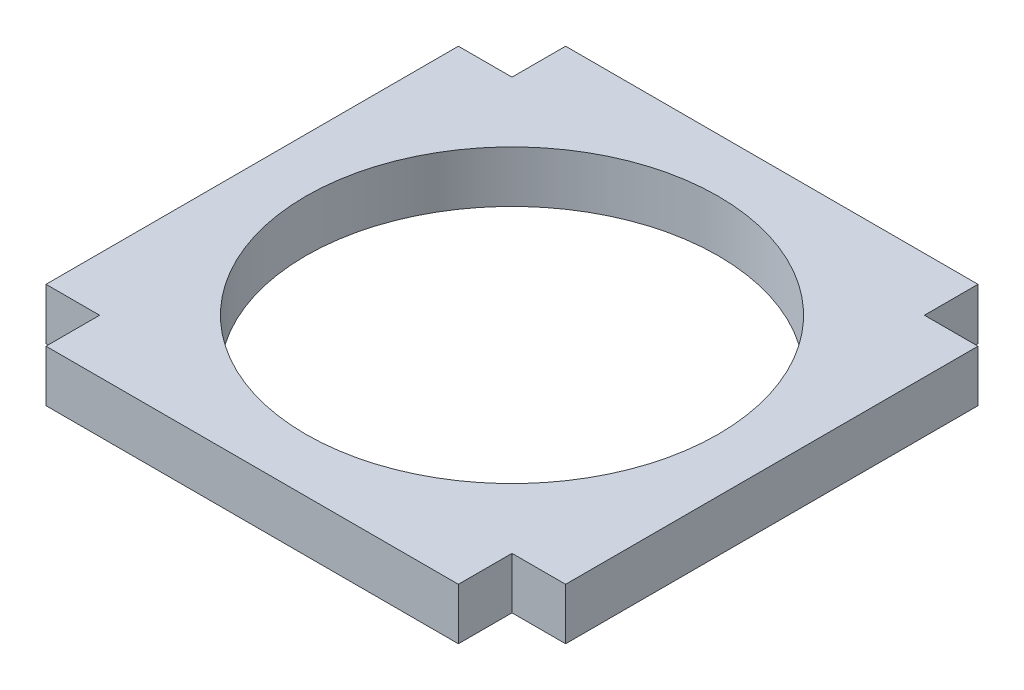
from build123d import *

# Parameters (mm, degrees)
SKETCH2_W                    = 304.8
SKETCH2_H                    = 304.8
BOSS_EXTRUDE1_DEPTH          = 3.175
CUT_EXTRUDE1_DEPTH           = 348.408852067
CUT_EXTRUDE1_DEPTH_BACK      = 348.408852067
SKETCH3_W                    = 304.8
SKETCH3_H                    = 304.8
SKETCH3_R                    = 12.7
SKETCH3_R_2                  = 8.89
BODY_DELETE_KEEP_1_OUTLINE_R = 8.89
BODY_DELETE_KEEP_1_DEPTH     = 3.175


# Read off the part's stored shape, not the designer's step: Body-Delete/Keep 1
with BuildPart() as part:
    # Sketch2 → Boss-Extrude1 (new body)
    with BuildSketch(Plane(origin=(0, 0, 0), x_dir=(1, 0, 0), z_dir=(0, 1, 0))):
        with Locations((-56.763509666, -124.968808797)):
            Rectangle(SKETCH2_W, SKETCH2_H)
    extrude(amount=BOSS_EXTRUDE1_DEPTH)

    # Sketch3 → Cut-Extrude1 (cut, two sides: drawn at the far end of the back side and taken through both)
    # profile 1 of 3: a face of its own
    with BuildSketch(Plane(origin=(0, 3.175, 0), x_dir=(1, 0, 0), z_dir=(0, 1, 0)).offset(-CUT_EXTRUDE1_DEPTH_BACK)):
        with Locations((-56.763509666, -124.968808797)):
            Rectangle(SKETCH3_W, SKETCH3_H)
        Polygon((-188.253637726, -268.695366412), (-192.063637726, -268.695366412), (-192.063637726, -265.393366412), (-198.413637726, -265.393366412), (-188.253637726, -205.195366412), align=None, mode=Mode.SUBTRACT)
        Polygon((-185.713637726, -265.393366412), (-175.553637726, -205.195366412), (-175.553637726, -268.695366412), (-179.363637726, -268.695366412), (-179.363637726, -265.393366412), align=None, mode=Mode.SUBTRACT)
        Polygon((-162.853637726, -268.695366412), (-166.663637726, -268.695366412), (-166.663637726, -265.393366412), (-173.013637726, -265.393366412), (-162.853637726, -205.195366412), align=None, mode=Mode.SUBTRACT)
        Polygon((-150.153637726, -268.695366412), (-153.963637726, -268.695366412), (-153.963637726, -265.393366412), (-160.313637726, -265.393366412), (-150.153637726, -205.195366412), align=None, mode=Mode.SUBTRACT)
        Polygon((-147.613637726, -265.393366412), (-137.453637726, -205.195366412), (-137.453637726, -268.695366412), (-141.263637726, -268.695366412), (-141.263637726, -265.393366412), align=None, mode=Mode.SUBTRACT)
        Polygon((-128.563637726, -265.393366412), (-134.913637726, -265.393366412), (-124.753637726, -205.195366412), (-124.753637726, -268.695366412), (-128.563637726, -268.695366412), align=None, mode=Mode.SUBTRACT)
        Polygon((-122.213637726, -265.393366412), (-112.053637726, -205.195366412), (-112.053637726, -268.695366412), (-115.863637726, -268.695366412), (-115.863637726, -265.393366412), align=None, mode=Mode.SUBTRACT)
        Polygon((-99.353637726, -268.695366412), (-103.163637726, -268.695366412), (-103.163637726, -265.393366412), (-109.513637726, -265.393366412), (-99.353637726, -205.195366412), align=None, mode=Mode.SUBTRACT)
        Polygon((-90.463637726, -268.695366412), (-90.463637726, -265.393366412), (-96.813637726, -265.393366412), (-86.653637726, -205.195366412), (-86.653637726, -268.695366412), align=None, mode=Mode.SUBTRACT)
        Polygon((-84.113637726, -265.393366412), (-73.953637726, -205.195366412), (-73.953637726, -268.695366412), (-77.763637726, -268.695366412), (-77.763637726, -265.393366412), align=None, mode=Mode.SUBTRACT)
        Polygon((-71.413637726, -265.393366412), (-61.253637726, -205.195366412), (-61.253637726, -268.695366412), (-65.063637726, -268.695366412), (-65.063637726, -265.393366412), align=None, mode=Mode.SUBTRACT)
        with BuildLine():
            ThreePointArc((-132.963509666, -135.600090559), (-133.446874634, -138.030130355), (-134.823381605, -140.09021862))
            Line((-134.823381605, -140.09021862), (-188.253637726, -193.520474741))
            ThreePointArc((-188.253637726, -193.520474741), (-190.313725991, -194.896981712), (-192.743765787, -195.38034668))
            Line((-192.743765787, -195.38034668), (-196.463509666, -195.38034668))
            Line((-196.463509666, -195.38034668), (-196.463509666, -131.88034668))
            Line((-196.463509666, -131.88034668), (-132.963509666, -131.88034668))
            Line((-132.963509666, -131.88034668), (-132.963509666, -135.600090559))
        make_face(mode=Mode.SUBTRACT)
        with BuildLine():
            Line((-126.613509666, -195.38034668), (-126.613509666, -131.88034668))
            Line((-126.613509666, -131.88034668), (-63.113509666, -131.88034668))
            Line((-63.113509666, -131.88034668), (-63.113509666, -135.600090559))
            ThreePointArc((-63.113509666, -135.600090559), (-63.596874634, -138.030130355), (-64.973381605, -140.09021862))
            Line((-64.973381605, -140.09021862), (-118.403637726, -193.520474741))
            ThreePointArc((-118.403637726, -193.520474741), (-120.463725991, -194.896981712), (-122.893765787, -195.38034668))
            Line((-122.893765787, -195.38034668), (-126.613509666, -195.38034668))
        make_face(mode=Mode.SUBTRACT)
        Polygon((-52.363637726, -268.695366412), (-52.363637726, -265.393366412), (-58.713637726, -265.393366412), (-48.553637726, -205.195366412), (-48.553637726, -268.695366412), align=None, mode=Mode.SUBTRACT)
        Polygon((-35.853637726, -205.195366412), (-35.853637726, -268.695366412), (-39.663637726, -268.695366412), (-39.663637726, -265.393366412), (-46.013637726, -265.393366412), align=None, mode=Mode.SUBTRACT)
        Polygon((-23.153637726, -205.195366412), (-23.153637726, -268.695366412), (-26.963637726, -268.695366412), (-26.963637726, -265.393366412), (-33.313637726, -265.393366412), align=None, mode=Mode.SUBTRACT)
        Polygon((-20.613637726, -265.393366412), (-10.453637726, -205.195366412), (-10.453637726, -268.695366412), (-14.263637726, -268.695366412), (-14.263637726, -265.393366412), align=None, mode=Mode.SUBTRACT)
        Polygon((-1.563637726, -268.695366412), (-1.563637726, -265.393366412), (-7.913637726, -265.393366412), (2.246362274, -205.195366412), (2.246362274, -268.695366412), align=None, mode=Mode.SUBTRACT)
        with BuildLine():
            Line((-53.043765787, -195.38034668), (-56.763509666, -195.38034668))
            Line((-56.763509666, -195.38034668), (-56.763509666, -131.88034668))
            Line((-56.763509666, -131.88034668), (6.736490334, -131.88034668))
            Line((6.736490334, -131.88034668), (6.736490334, -135.600090559))
            ThreePointArc((6.736490334, -135.600090559), (6.253125366, -138.030130355), (4.876618395, -140.09021862))
            Line((4.876618395, -140.09021862), (-48.553637726, -193.520474741))
            ThreePointArc((-48.553637726, -193.520474741), (-50.613725991, -194.896981712), (-53.043765787, -195.38034668))
        make_face(mode=Mode.SUBTRACT)
        with BuildLine():
            Line((13.086490334, -131.88034668), (76.586490334, -131.88034668))
            Line((76.586490334, -131.88034668), (76.586490334, -135.600090559))
            ThreePointArc((76.586490334, -135.600090559), (76.103125366, -138.030130355), (74.726618395, -140.09021862))
            Line((74.726618395, -140.09021862), (21.296362274, -193.520474741))
            ThreePointArc((21.296362274, -193.520474741), (19.236274009, -194.896981712), (16.806234213, -195.38034668))
            Line((16.806234213, -195.38034668), (13.086490334, -195.38034668))
            Line((13.086490334, -195.38034668), (13.086490334, -131.88034668))
        make_face(mode=Mode.SUBTRACT)
        with BuildLine():
            Line((-196.463509666, -125.53034668), (-196.463509666, -62.03034668))
            Line((-196.463509666, -62.03034668), (-132.963509666, -62.03034668))
            Line((-132.963509666, -62.03034668), (-132.963509666, -65.750090559))
            ThreePointArc((-132.963509666, -65.750090559), (-133.10773728, -67.095783354), (-133.533868437, -68.38034668))
            ThreePointArc((-133.533868437, -68.38034668), (-134.095097913, -69.368194866), (-134.823381605, -70.24021862))
            Line((-134.823381605, -70.24021862), (-188.253637726, -123.670474741))
            ThreePointArc((-188.253637726, -123.670474741), (-189.12566148, -124.398758433), (-190.113509666, -124.959987909))
            ThreePointArc((-190.113509666, -124.959987909), (-191.398072992, -125.386119066), (-192.743765787, -125.53034668))
            Line((-192.743765787, -125.53034668), (-196.463509666, -125.53034668))
        make_face(mode=Mode.SUBTRACT)
        with BuildLine():
            Line((-122.893765787, -125.53034668), (-126.613509666, -125.53034668))
            Line((-126.613509666, -125.53034668), (-126.613509666, -62.03034668))
            Line((-126.613509666, -62.03034668), (-63.113509666, -62.03034668))
            Line((-63.113509666, -62.03034668), (-63.113509666, -65.750090559))
            ThreePointArc((-63.113509666, -65.750090559), (-63.596874634, -68.180130355), (-64.973381605, -70.24021862))
            Line((-64.973381605, -70.24021862), (-118.403637726, -123.670474741))
            ThreePointArc((-118.403637726, -123.670474741), (-120.463725991, -125.046981712), (-122.893765787, -125.53034668))
        make_face(mode=Mode.SUBTRACT)
        Polygon((-196.463509666, -48.768808797), (-196.463509666, 14.731191203), (-192.653509666, 14.731191203), (-192.653509666, 11.429191203), (-186.303509666, 11.429191203), align=None, mode=Mode.SUBTRACT)
        Polygon((-183.763509666, 14.731191203), (-179.953509666, 14.731191203), (-179.953509666, 11.429191203), (-173.603509666, 11.429191203), (-183.763509666, -48.768808797), align=None, mode=Mode.SUBTRACT)
        Polygon((-171.063509666, 14.731191203), (-167.253509666, 14.731191203), (-167.253509666, 11.429191203), (-160.903509666, 11.429191203), (-171.063509666, -48.768808797), align=None, mode=Mode.SUBTRACT)
        Polygon((-158.363509666, 14.731191203), (-154.553509666, 14.731191203), (-154.553509666, 11.429191203), (-148.203509666, 11.429191203), (-158.363509666, -48.768808797), align=None, mode=Mode.SUBTRACT)
        Polygon((-145.663509666, 14.731191203), (-141.853509666, 14.731191203), (-141.853509666, 11.429191203), (-135.503509666, 11.429191203), (-145.663509666, -48.768808797), align=None, mode=Mode.SUBTRACT)
        Polygon((-132.963509666, 14.731191203), (-129.153509666, 14.731191203), (-129.153509666, 11.429191203), (-122.803509666, 11.429191203), (-132.963509666, -48.768808797), align=None, mode=Mode.SUBTRACT)
        Polygon((-120.263509666, 14.731191203), (-116.453509666, 14.731191203), (-116.453509666, 11.429191203), (-110.103509666, 11.429191203), (-120.263509666, -48.768808797), align=None, mode=Mode.SUBTRACT)
        Polygon((-107.563509666, 14.731191203), (-103.753509666, 14.731191203), (-103.753509666, 11.429191203), (-97.403509666, 11.429191203), (-107.563509666, -48.768808797), align=None, mode=Mode.SUBTRACT)
        Polygon((-94.863509666, 14.731191203), (-91.053509666, 14.731191203), (-91.053509666, 11.429191203), (-84.703509666, 11.429191203), (-94.863509666, -48.768808797), align=None, mode=Mode.SUBTRACT)
        Polygon((-82.163509666, 14.731191203), (-78.353509666, 14.731191203), (-78.353509666, 11.429191203), (-72.003509666, 11.429191203), (-82.163509666, -48.768808797), align=None, mode=Mode.SUBTRACT)
        Polygon((-69.463509666, 14.731191203), (-65.653509666, 14.731191203), (-65.653509666, 11.429191203), (-59.303509666, 11.429191203), (-69.463509666, -48.768808797), align=None, mode=Mode.SUBTRACT)
        with BuildLine():
            Line((-53.043765787, -125.53034668), (-56.763509666, -125.53034668))
            Line((-56.763509666, -125.53034668), (-56.763509666, -62.03034668))
            Line((-56.763509666, -62.03034668), (6.736490334, -62.03034668))
            Line((6.736490334, -62.03034668), (6.736490334, -65.750090559))
            ThreePointArc((6.736490334, -65.750090559), (6.253125366, -68.180130355), (4.876618395, -70.24021862))
            Line((4.876618395, -70.24021862), (-48.553637726, -123.670474741))
            ThreePointArc((-48.553637726, -123.670474741), (-50.613725991, -125.046981712), (-53.043765787, -125.53034668))
        make_face(mode=Mode.SUBTRACT)
        with BuildLine():
            Line((16.806234213, -125.53034668), (13.086490334, -125.53034668))
            Line((13.086490334, -125.53034668), (13.086490334, -62.03034668))
            Line((13.086490334, -62.03034668), (76.586490334, -62.03034668))
            Line((76.586490334, -62.03034668), (76.586490334, -65.750090559))
            ThreePointArc((76.586490334, -65.750090559), (76.103125366, -68.180130355), (74.726618395, -70.24021862))
            Line((74.726618395, -70.24021862), (21.296362274, -123.670474741))
            ThreePointArc((21.296362274, -123.670474741), (19.236274009, -125.046981712), (16.806234213, -125.53034668))
        make_face(mode=Mode.SUBTRACT)
        Polygon((-56.763509666, 14.731191203), (-52.953509666, 14.731191203), (-52.953509666, 11.429191203), (-46.603509666, 11.429191203), (-56.763509666, -48.768808797), align=None, mode=Mode.SUBTRACT)
        Polygon((-44.063509666, 14.731191203), (-40.253509666, 14.731191203), (-40.253509666, 11.429191203), (-33.903509666, 11.429191203), (-44.063509666, -48.768808797), align=None, mode=Mode.SUBTRACT)
        Polygon((-31.363509666, 14.731191203), (-27.553509666, 14.731191203), (-27.553509666, 11.429191203), (-21.203509666, 11.429191203), (-31.363509666, -48.768808797), align=None, mode=Mode.SUBTRACT)
        Polygon((-18.663509666, 14.731191203), (-14.853509666, 14.731191203), (-14.853509666, 11.429191203), (-8.503509666, 11.429191203), (-18.663509666, -48.768808797), align=None, mode=Mode.SUBTRACT)
        Polygon((-5.963509666, 14.731191203), (-2.153509666, 14.731191203), (-2.153509666, 11.429191203), (4.196490334, 11.429191203), (-5.963509666, -48.768808797), align=None, mode=Mode.SUBTRACT)
        Polygon((57.536490334, -48.768808797), (57.536490334, -52.070808797), (32.136490334, -52.070808797), (32.136490334, -48.768808797), (28.834490334, -48.768808797), (28.834490334, -23.368808797), (32.136490334, -23.368808797), (32.136490334, -20.066808797), (57.536490334, -20.066808797), (57.536490334, -23.368808797), (60.838490334, -23.368808797), (60.838490334, -48.768808797), align=None, mode=Mode.SUBTRACT)
        Polygon((28.834490334, 14.731191203), (32.136490334, 14.731191203), (32.136490334, 18.033191203), (57.536490334, 18.033191203), (57.536490334, 14.731191203), (60.838490334, 14.731191203), (60.838490334, -10.668808797), (57.536490334, -10.668808797), (57.536490334, -13.970808797), (32.136490334, -13.970808797), (32.136490334, -10.668808797), (28.834490334, -10.668808797), align=None, mode=Mode.SUBTRACT)
    # profile 2 of 3: a face of its own
    with BuildSketch(Plane(origin=(0, 3.175, 0), x_dir=(1, 0, 0), z_dir=(0, 1, 0)).offset(-CUT_EXTRUDE1_DEPTH_BACK)):
        with Locations(Location((44.836490334, -36.068808797, 0), (0, 0, 270))):
            Circle(SKETCH3_R)
    # profile 3 of 3: a face of its own
    with BuildSketch(Plane(origin=(0, 3.175, 0), x_dir=(1, 0, 0), z_dir=(0, 1, 0)).offset(-CUT_EXTRUDE1_DEPTH_BACK)):
        with Locations(Location((44.836490334, 2.031191203, 0), (0, 0, 270))):
            Circle(SKETCH3_R_2)
    extrude(amount=CUT_EXTRUDE1_DEPTH + CUT_EXTRUDE1_DEPTH_BACK, mode=Mode.SUBTRACT)

    # Body-Delete/Keep 1 outline → Body-Delete/Keep 1 (cut)
    # profile 1 of 41: a face of its own
    with BuildSketch(Plane(origin=(0, 0, 0), x_dir=(1, 0, 0), z_dir=(0, 1, 0))):
        Polygon((28.834490334, -10.668808797), (32.136490334, -10.668808797), (32.136490334, -13.970808797), (57.536490334, -13.970808797), (57.536490334, -10.668808797), (60.838490334, -10.668808797), (60.838490334, 14.731191203), (57.536490334, 14.731191203), (57.536490334, 18.033191203), (32.136490334, 18.033191203), (32.136490334, 14.731191203), (28.834490334, 14.731191203), align=None)
        with Locations((44.836490334, 2.031191203)):
            Circle(BODY_DELETE_KEEP_1_OUTLINE_R, mode=Mode.SUBTRACT)
    # profile 2 of 41: a face of its own
    with BuildSketch(Plane(origin=(0, 0, 0), x_dir=(1, 0, 0), z_dir=(0, 1, 0))):
        Polygon((-192.653509666, 11.429191203), (-192.653509666, 14.731191203), (-196.463509666, 14.731191203), (-196.463509666, -48.768808797), (-186.303509666, 11.429191203), align=None)
    # profile 3 of 41: a face of its own
    with BuildSketch(Plane(origin=(0, 0, 0), x_dir=(1, 0, 0), z_dir=(0, 1, 0))):
        Polygon((-2.153509666, 11.429191203), (-2.153509666, 14.731191203), (-5.963509666, 14.731191203), (-5.963509666, -48.768808797), (4.196490334, 11.429191203), align=None)
    # profile 4 of 41: a face of its own
    with BuildSketch(Plane(origin=(0, 0, 0), x_dir=(1, 0, 0), z_dir=(0, 1, 0))):
        Polygon((-27.553509666, 11.429191203), (-27.553509666, 14.731191203), (-31.363509666, 14.731191203), (-31.363509666, -48.768808797), (-21.203509666, 11.429191203), align=None)
    # profile 5 of 41: a face of its own
    with BuildSketch(Plane(origin=(0, 0, 0), x_dir=(1, 0, 0), z_dir=(0, 1, 0))):
        Polygon((-14.853509666, 11.429191203), (-14.853509666, 14.731191203), (-18.663509666, 14.731191203), (-18.663509666, -48.768808797), (-8.503509666, 11.429191203), align=None)
    # profile 6 of 41: a face of its own
    with BuildSketch(Plane(origin=(0, 0, 0), x_dir=(1, 0, 0), z_dir=(0, 1, 0))):
        Polygon((-65.653509666, 11.429191203), (-65.653509666, 14.731191203), (-69.463509666, 14.731191203), (-69.463509666, -48.768808797), (-59.303509666, 11.429191203), align=None)
    # profile 7 of 41: a face of its own
    with BuildSketch(Plane(origin=(0, 0, 0), x_dir=(1, 0, 0), z_dir=(0, 1, 0))):
        Polygon((-91.053509666, 11.429191203), (-91.053509666, 14.731191203), (-94.863509666, 14.731191203), (-94.863509666, -48.768808797), (-84.703509666, 11.429191203), align=None)
    # profile 8 of 41: a face of its own
    with BuildSketch(Plane(origin=(0, 0, 0), x_dir=(1, 0, 0), z_dir=(0, 1, 0))):
        Polygon((-40.253509666, 11.429191203), (-40.253509666, 14.731191203), (-44.063509666, 14.731191203), (-44.063509666, -48.768808797), (-33.903509666, 11.429191203), align=None)
    # profile 9 of 41: a face of its own
    with BuildSketch(Plane(origin=(0, 0, 0), x_dir=(1, 0, 0), z_dir=(0, 1, 0))):
        Polygon((-52.953509666, 11.429191203), (-52.953509666, 14.731191203), (-56.763509666, 14.731191203), (-56.763509666, -48.768808797), (-46.603509666, 11.429191203), align=None)
    # profile 10 of 41: a face of its own
    with BuildSketch(Plane(origin=(0, 0, 0), x_dir=(1, 0, 0), z_dir=(0, 1, 0))):
        Polygon((-141.853509666, 11.429191203), (-141.853509666, 14.731191203), (-145.663509666, 14.731191203), (-145.663509666, -48.768808797), (-135.503509666, 11.429191203), align=None)
    # profile 11 of 41: a face of its own
    with BuildSketch(Plane(origin=(0, 0, 0), x_dir=(1, 0, 0), z_dir=(0, 1, 0))):
        Polygon((-154.553509666, 11.429191203), (-154.553509666, 14.731191203), (-158.363509666, 14.731191203), (-158.363509666, -48.768808797), (-148.203509666, 11.429191203), align=None)
    # profile 12 of 41: a face of its own
    with BuildSketch(Plane(origin=(0, 0, 0), x_dir=(1, 0, 0), z_dir=(0, 1, 0))):
        Polygon((-167.253509666, 11.429191203), (-167.253509666, 14.731191203), (-171.063509666, 14.731191203), (-171.063509666, -48.768808797), (-160.903509666, 11.429191203), align=None)
    # profile 13 of 41: a face of its own
    with BuildSketch(Plane(origin=(0, 0, 0), x_dir=(1, 0, 0), z_dir=(0, 1, 0))):
        Polygon((-78.353509666, 11.429191203), (-78.353509666, 14.731191203), (-82.163509666, 14.731191203), (-82.163509666, -48.768808797), (-72.003509666, 11.429191203), align=None)
    # profile 14 of 41: a face of its own
    with BuildSketch(Plane(origin=(0, 0, 0), x_dir=(1, 0, 0), z_dir=(0, 1, 0))):
        Polygon((-179.953509666, 11.429191203), (-179.953509666, 14.731191203), (-183.763509666, 14.731191203), (-183.763509666, -48.768808797), (-173.603509666, 11.429191203), align=None)
    # profile 15 of 41: a face of its own
    with BuildSketch(Plane(origin=(0, 0, 0), x_dir=(1, 0, 0), z_dir=(0, 1, 0))):
        Polygon((-103.753509666, 11.429191203), (-103.753509666, 14.731191203), (-107.563509666, 14.731191203), (-107.563509666, -48.768808797), (-97.403509666, 11.429191203), align=None)
    # profile 16 of 41: a face of its own
    with BuildSketch(Plane(origin=(0, 0, 0), x_dir=(1, 0, 0), z_dir=(0, 1, 0))):
        Polygon((-116.453509666, 11.429191203), (-116.453509666, 14.731191203), (-120.263509666, 14.731191203), (-120.263509666, -48.768808797), (-110.103509666, 11.429191203), align=None)
    # profile 17 of 41: a face of its own
    with BuildSketch(Plane(origin=(0, 0, 0), x_dir=(1, 0, 0), z_dir=(0, 1, 0))):
        Polygon((-129.153509666, 11.429191203), (-129.153509666, 14.731191203), (-132.963509666, 14.731191203), (-132.963509666, -48.768808797), (-122.803509666, 11.429191203), align=None)
    # profile 18 of 41: a face of its own
    with BuildSketch(Plane(origin=(0, 0, 0), x_dir=(1, 0, 0), z_dir=(0, 1, 0))):
        Polygon((-71.413637726, -265.393366412), (-65.063637726, -265.393366412), (-65.063637726, -268.695366412), (-61.253637726, -268.695366412), (-61.253637726, -205.195366412), align=None)
    # profile 19 of 41: a face of its own
    with BuildSketch(Plane(origin=(0, 0, 0), x_dir=(1, 0, 0), z_dir=(0, 1, 0))):
        Polygon((-124.753637726, -205.195366412), (-134.913637726, -265.393366412), (-128.563637726, -265.393366412), (-128.563637726, -268.695366412), (-124.753637726, -268.695366412), align=None)
    # profile 20 of 41: a face of its own
    with BuildSketch(Plane(origin=(0, 0, 0), x_dir=(1, 0, 0), z_dir=(0, 1, 0))):
        Polygon((-23.153637726, -205.195366412), (-33.313637726, -265.393366412), (-26.963637726, -265.393366412), (-26.963637726, -268.695366412), (-23.153637726, -268.695366412), align=None)
    # profile 21 of 41: a face of its own
    with BuildSketch(Plane(origin=(0, 0, 0), x_dir=(1, 0, 0), z_dir=(0, 1, 0))):
        Polygon((-35.853637726, -205.195366412), (-46.013637726, -265.393366412), (-39.663637726, -265.393366412), (-39.663637726, -268.695366412), (-35.853637726, -268.695366412), align=None)
    # profile 22 of 41: a face of its own
    with BuildSketch(Plane(origin=(0, 0, 0), x_dir=(1, 0, 0), z_dir=(0, 1, 0))):
        Polygon((-73.953637726, -205.195366412), (-84.113637726, -265.393366412), (-77.763637726, -265.393366412), (-77.763637726, -268.695366412), (-73.953637726, -268.695366412), align=None)
    # profile 23 of 41: a face of its own
    with BuildSketch(Plane(origin=(0, 0, 0), x_dir=(1, 0, 0), z_dir=(0, 1, 0))):
        Polygon((-162.853637726, -205.195366412), (-173.013637726, -265.393366412), (-166.663637726, -265.393366412), (-166.663637726, -268.695366412), (-162.853637726, -268.695366412), align=None)
    # profile 24 of 41: a face of its own
    with BuildSketch(Plane(origin=(0, 0, 0), x_dir=(1, 0, 0), z_dir=(0, 1, 0))):
        Polygon((-188.253637726, -205.195366412), (-198.413637726, -265.393366412), (-192.063637726, -265.393366412), (-192.063637726, -268.695366412), (-188.253637726, -268.695366412), align=None)
    # profile 25 of 41: a face of its own
    with BuildSketch(Plane(origin=(0, 0, 0), x_dir=(1, 0, 0), z_dir=(0, 1, 0))):
        Polygon((-175.553637726, -205.195366412), (-185.713637726, -265.393366412), (-179.363637726, -265.393366412), (-179.363637726, -268.695366412), (-175.553637726, -268.695366412), align=None)
    # profile 26 of 41: a face of its own
    with BuildSketch(Plane(origin=(0, 0, 0), x_dir=(1, 0, 0), z_dir=(0, 1, 0))):
        Polygon((-150.153637726, -205.195366412), (-160.313637726, -265.393366412), (-153.963637726, -265.393366412), (-153.963637726, -268.695366412), (-150.153637726, -268.695366412), align=None)
    # profile 27 of 41: a face of its own
    with BuildSketch(Plane(origin=(0, 0, 0), x_dir=(1, 0, 0), z_dir=(0, 1, 0))):
        Polygon((-86.653637726, -205.195366412), (-96.813637726, -265.393366412), (-90.463637726, -265.393366412), (-90.463637726, -268.695366412), (-86.653637726, -268.695366412), align=None)
    # profile 28 of 41: a face of its own
    with BuildSketch(Plane(origin=(0, 0, 0), x_dir=(1, 0, 0), z_dir=(0, 1, 0))):
        Polygon((2.246362274, -205.195366412), (-7.913637726, -265.393366412), (-1.563637726, -265.393366412), (-1.563637726, -268.695366412), (2.246362274, -268.695366412), align=None)
    # profile 29 of 41: a face of its own
    with BuildSketch(Plane(origin=(0, 0, 0), x_dir=(1, 0, 0), z_dir=(0, 1, 0))):
        Polygon((-137.453637726, -205.195366412), (-147.613637726, -265.393366412), (-141.263637726, -265.393366412), (-141.263637726, -268.695366412), (-137.453637726, -268.695366412), align=None)
    # profile 30 of 41: a face of its own
    with BuildSketch(Plane(origin=(0, 0, 0), x_dir=(1, 0, 0), z_dir=(0, 1, 0))):
        Polygon((-48.553637726, -205.195366412), (-58.713637726, -265.393366412), (-52.363637726, -265.393366412), (-52.363637726, -268.695366412), (-48.553637726, -268.695366412), align=None)
    # profile 31 of 41: a face of its own
    with BuildSketch(Plane(origin=(0, 0, 0), x_dir=(1, 0, 0), z_dir=(0, 1, 0))):
        Polygon((-10.453637726, -205.195366412), (-20.613637726, -265.393366412), (-14.263637726, -265.393366412), (-14.263637726, -268.695366412), (-10.453637726, -268.695366412), align=None)
    # profile 32 of 41: a face of its own
    with BuildSketch(Plane(origin=(0, 0, 0), x_dir=(1, 0, 0), z_dir=(0, 1, 0))):
        Polygon((-99.353637726, -205.195366412), (-109.513637726, -265.393366412), (-103.163637726, -265.393366412), (-103.163637726, -268.695366412), (-99.353637726, -268.695366412), align=None)
    # profile 33 of 41: a face of its own
    with BuildSketch(Plane(origin=(0, 0, 0), x_dir=(1, 0, 0), z_dir=(0, 1, 0))):
        Polygon((-112.053637726, -205.195366412), (-122.213637726, -265.393366412), (-115.863637726, -265.393366412), (-115.863637726, -268.695366412), (-112.053637726, -268.695366412), align=None)
    # profile 34 of 41: a face of its own
    with BuildSketch(Plane(origin=(0, 0, 0), x_dir=(1, 0, 0), z_dir=(0, 1, 0))):
        with BuildLine():
            Line((-132.963509666, -62.03034668), (-196.463509666, -62.03034668))
            Line((-196.463509666, -62.03034668), (-196.463509666, -125.53034668))
            Line((-196.463509666, -125.53034668), (-192.743765787, -125.53034668))
            ThreePointArc((-192.743765787, -125.53034668), (-190.313725991, -125.046981712), (-188.253637726, -123.670474741))
            Line((-188.253637726, -123.670474741), (-134.823381605, -70.24021862))
            ThreePointArc((-134.823381605, -70.24021862), (-133.446874634, -68.180130355), (-132.963509666, -65.750090559))
            Line((-132.963509666, -65.750090559), (-132.963509666, -62.03034668))
        make_face()
    # profile 35 of 41: a face of its own
    with BuildSketch(Plane(origin=(0, 0, 0), x_dir=(1, 0, 0), z_dir=(0, 1, 0))):
        with BuildLine():
            Line((-132.963509666, -131.88034668), (-196.463509666, -131.88034668))
            Line((-196.463509666, -131.88034668), (-196.463509666, -195.38034668))
            Line((-196.463509666, -195.38034668), (-192.743765787, -195.38034668))
            ThreePointArc((-192.743765787, -195.38034668), (-190.313725991, -194.896981712), (-188.253637726, -193.520474741))
            Line((-188.253637726, -193.520474741), (-134.823381605, -140.09021862))
            ThreePointArc((-134.823381605, -140.09021862), (-133.446874634, -138.030130355), (-132.963509666, -135.600090559))
            Line((-132.963509666, -135.600090559), (-132.963509666, -131.88034668))
        make_face()
    # profile 36 of 41: a face of its own
    with BuildSketch(Plane(origin=(0, 0, 0), x_dir=(1, 0, 0), z_dir=(0, 1, 0))):
        with BuildLine():
            Line((6.736490334, -131.88034668), (-56.763509666, -131.88034668))
            Line((-56.763509666, -131.88034668), (-56.763509666, -195.38034668))
            Line((-56.763509666, -195.38034668), (-53.043765787, -195.38034668))
            ThreePointArc((-53.043765787, -195.38034668), (-50.613725991, -194.896981712), (-48.553637726, -193.520474741))
            Line((-48.553637726, -193.520474741), (4.876618395, -140.09021862))
            ThreePointArc((4.876618395, -140.09021862), (6.253125366, -138.030130355), (6.736490334, -135.600090559))
            Line((6.736490334, -135.600090559), (6.736490334, -131.88034668))
        make_face()
    # profile 37 of 41: a face of its own
    with BuildSketch(Plane(origin=(0, 0, 0), x_dir=(1, 0, 0), z_dir=(0, 1, 0))):
        with BuildLine():
            Line((6.736490334, -62.03034668), (-56.763509666, -62.03034668))
            Line((-56.763509666, -62.03034668), (-56.763509666, -125.53034668))
            Line((-56.763509666, -125.53034668), (-53.043765787, -125.53034668))
            ThreePointArc((-53.043765787, -125.53034668), (-50.613725991, -125.046981712), (-48.553637726, -123.670474741))
            Line((-48.553637726, -123.670474741), (4.876618395, -70.24021862))
            ThreePointArc((4.876618395, -70.24021862), (6.253125366, -68.180130355), (6.736490334, -65.750090559))
            Line((6.736490334, -65.750090559), (6.736490334, -62.03034668))
        make_face()
    # profile 38 of 41: a face of its own
    with BuildSketch(Plane(origin=(0, 0, 0), x_dir=(1, 0, 0), z_dir=(0, 1, 0))):
        with BuildLine():
            Line((21.296362274, -193.520474741), (74.726618395, -140.09021862))
            ThreePointArc((74.726618395, -140.09021862), (76.103125366, -138.030130355), (76.586490334, -135.600090559))
            Line((76.586490334, -135.600090559), (76.586490334, -131.88034668))
            Line((76.586490334, -131.88034668), (13.086490334, -131.88034668))
            Line((13.086490334, -131.88034668), (13.086490334, -195.38034668))
            Line((13.086490334, -195.38034668), (16.806234213, -195.38034668))
            ThreePointArc((16.806234213, -195.38034668), (19.236274009, -194.896981712), (21.296362274, -193.520474741))
        make_face()
    # profile 39 of 41: a face of its own
    with BuildSketch(Plane(origin=(0, 0, 0), x_dir=(1, 0, 0), z_dir=(0, 1, 0))):
        with BuildLine():
            Line((-126.613509666, -131.88034668), (-126.613509666, -195.38034668))
            Line((-126.613509666, -195.38034668), (-122.893765787, -195.38034668))
            ThreePointArc((-122.893765787, -195.38034668), (-120.463725991, -194.896981712), (-118.403637726, -193.520474741))
            Line((-118.403637726, -193.520474741), (-64.973381605, -140.09021862))
            ThreePointArc((-64.973381605, -140.09021862), (-63.596874634, -138.030130355), (-63.113509666, -135.600090559))
            Line((-63.113509666, -135.600090559), (-63.113509666, -131.88034668))
            Line((-63.113509666, -131.88034668), (-126.613509666, -131.88034668))
        make_face()
    # profile 40 of 41: a face of its own
    with BuildSketch(Plane(origin=(0, 0, 0), x_dir=(1, 0, 0), z_dir=(0, 1, 0))):
        with BuildLine():
            Line((76.586490334, -62.03034668), (13.086490334, -62.03034668))
            Line((13.086490334, -62.03034668), (13.086490334, -125.53034668))
            Line((13.086490334, -125.53034668), (16.806234213, -125.53034668))
            ThreePointArc((16.806234213, -125.53034668), (19.236274009, -125.046981712), (21.296362274, -123.670474741))
            Line((21.296362274, -123.670474741), (74.726618395, -70.24021862))
            ThreePointArc((74.726618395, -70.24021862), (76.103125366, -68.180130355), (76.586490334, -65.750090559))
            Line((76.586490334, -65.750090559), (76.586490334, -62.03034668))
        make_face()
    # profile 41 of 41: a face of its own
    with BuildSketch(Plane(origin=(0, 0, 0), x_dir=(1, 0, 0), z_dir=(0, 1, 0))):
        with BuildLine():
            Line((-126.613509666, -62.03034668), (-126.613509666, -125.53034668))
            Line((-126.613509666, -125.53034668), (-122.893765787, -125.53034668))
            ThreePointArc((-122.893765787, -125.53034668), (-120.463725991, -125.046981712), (-118.403637726, -123.670474741))
            Line((-118.403637726, -123.670474741), (-64.973381605, -70.24021862))
            ThreePointArc((-64.973381605, -70.24021862), (-63.596874634, -68.180130355), (-63.113509666, -65.750090559))
            Line((-63.113509666, -65.750090559), (-63.113509666, -62.03034668))
            Line((-63.113509666, -62.03034668), (-126.613509666, -62.03034668))
        make_face()
    extrude(amount=BODY_DELETE_KEEP_1_DEPTH, mode=Mode.SUBTRACT)


solid = part.part
